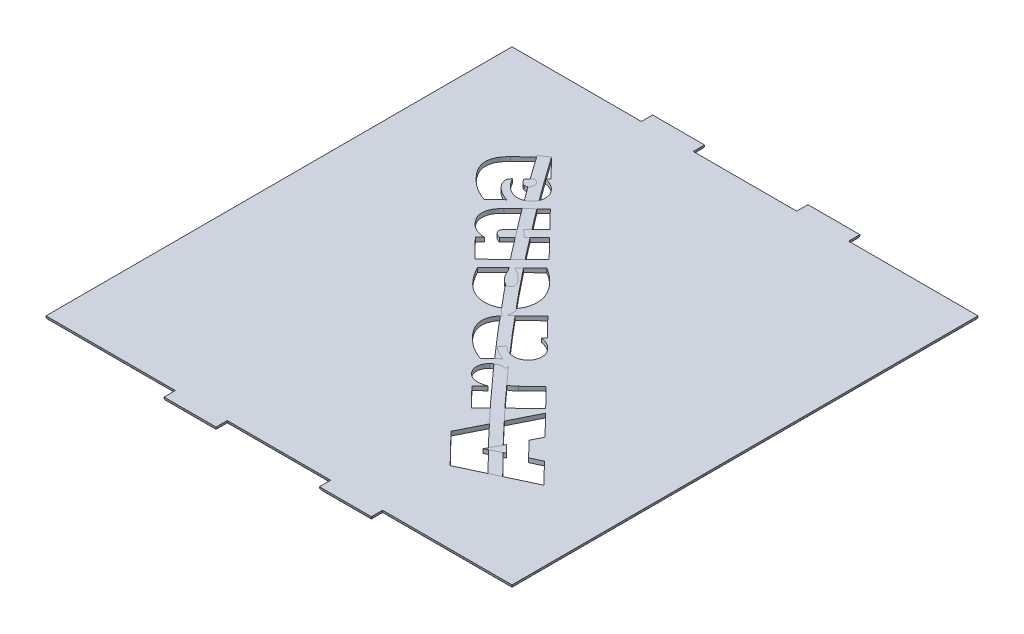
from build123d import *

# Parameters (mm, degrees)
SKETCH3_W           = 89.69
SKETCH3_H           = 89.69000000000001
BOSS_EXTRUDE1_DEPTH = 0.8
BOSS_EXTRUDE2_DEPTH = 2.166
CIRPATTERN1_COUNT   = 2
CUT_EXTRUDE1_DEPTH  = 65.9749809234293
EXTRUDE_THIN5_START = -0.8
EXTRUDE_THIN5_DEPTH = 0.8
FILLET1_R           = 0.7


# Read off the part's stored shape, not the designer's step: Extrude-Thin5
with BuildPart() as part:
    # Sketch3 → Boss-Extrude1 (new body)
    with BuildSketch(Plane(origin=(0, 0, 0), x_dir=(1, 0, 0), z_dir=(0, 1, 0))):
        Rectangle(SKETCH3_W, SKETCH3_H)
    extrude(amount=BOSS_EXTRUDE1_DEPTH)

    # 3DSketch2 → Boss-Extrude2 (add)
    with BuildSketch(Plane(origin=(-9.95034, 0.8, -44.84500000000001), x_dir=(0.9996421745782685, -0.026749258016448483, 0), z_dir=(0, 0, -1))):
        Polygon((0, 0), (-9.996421745782685, 0.26749258016448485), (-9.975022339369527, 1.0672063198270998), (0.02139940641315879, 0.7997137396626148), align=None)
        Polygon((19.889550465666197, -0.53222115949813), (29.885972211448884, -0.7997137396626148), (29.90737161786204, 0), (19.910949872079353, 0.26749258016448485), align=None)
    boss_extrude2 = extrude(amount=BOSS_EXTRUDE2_DEPTH)

    # CirPattern1: Boss-Extrude2 ×2 about axis
    cirpattern1_axis = Axis((0, 0, 0), (0, 1, 0))
    for i in range(1, CIRPATTERN1_COUNT):
        add(boss_extrude2.rotate(cirpattern1_axis, i * 360 / CIRPATTERN1_COUNT))

    # Sketch6 → Cut-Extrude1 (cut, through all)
    # profile 1 of 6: a face of its own
    with BuildSketch(Plane(origin=(0, 0.8, 0), x_dir=(1, 0, 0), z_dir=(0, 1, 0))):
        Polygon((27.345661875247625, -21.096446060445984), (31.303026911258364, -25.166449569967465), (19.007911758263578, -30.913514796204446), (13.368478851159088, -25.11388494899579), (19.453459497928293, -12.98146981329429), (23.408321456749906, -17.04897024562665), (22.36704134607282, -19.088978154765645), (25.275617039839098, -22.077652318584004), align=None)
        Polygon((22.387065963585844, -23.444332463847672), (20.920262730757067, -21.937479995992856), (19.370857950687082, -24.91113569667645), align=None, mode=Mode.SUBTRACT)
    # profile 2 of 6: a face of its own
    with BuildSketch(Plane(origin=(0, 0.8, 0), x_dir=(1, 0, 0), z_dir=(0, 1, 0))):
        with BuildLine():
            add(Edge.make_bspline(
                [(9.400871000961562, -13.988766329086499), (9.30525286068596, -14.023952983668208), (9.117966243026586, -14.09287285080181), (8.83709843493686, -14.177615368293507), (8.56405297163511, -14.246146980475793), (8.29884162387254, -14.295082923044426), (8.042722211750768, -14.33256636169078), (7.794093087022929, -14.346794708899012), (7.5531837904540495, -14.344860433968732), (7.319685892106796, -14.324865851185468), (7.0943759280280085, -14.287779506459136), (6.877565148803457, -14.232225465589547), (6.66888112253963, -14.15968637297079), (6.4687256832569835, -14.068523267258296), (6.273881875267599, -13.96387030835028), (6.089294906722166, -13.838100730971776), (5.912587694344752, -13.694831347614109), (5.803922108485169, -13.587547258560662), (5.748881382024389, -13.533206280665274)],
                knots=[0, 0, 0, 0, 1.2470968480417834, 2.442680331265641, 3.5897166425600027, 4.691564114130364, 5.743217333763314, 6.756314169319222, 7.736965036863193, 8.6904272369132, 9.622418292096572, 10.529158202777579, 11.427226509285706, 12.32331758601569, 13.219233991795686, 14.131480470769954, 15.053567222028589, 16, 16, 16, 16], degree=3))
            add(Edge.make_bspline(
                [(5.748881382024389, -13.533206280665274), (5.690136753953278, -13.469981527582018), (5.575370318719674, -13.346462496682598), (5.42612666426808, -13.147312162314009), (5.304275881076175, -12.940288612475973), (5.199234189581776, -12.729967700538477), (5.121346442661915, -12.510609254452023), (5.069031160605179, -12.283723286144768), (5.03929421575713, -12.05063127589298), (5.031122655860338, -11.813327592436481), (5.049111203482392, -11.57688206658625), (5.089251745516087, -11.344629081981457), (5.15210003632347, -11.11909525384816), (5.2364269611829375, -10.899991027256927), (5.3491682080941, -10.690837250699003), (5.482676468053031, -10.487697498213414), (5.636537331258983, -10.289054728112454), (5.755931499340013, -10.16791272812565), (5.816464466130834, -10.106493608749586)],
                knots=[0, 0, 0, 0, 1.0780730738855722, 2.10617732503832, 3.1022150396295256, 4.076846698501837, 5.039863495431567, 6.003501029278832, 6.981251161032279, 7.972309886930025, 8.965560253553598, 9.939243256954995, 10.913205372588985, 11.887167488222978, 12.866695146964533, 13.876015758160129, 14.923137791049747, 15.999999999999998, 15.999999999999998, 15.999999999999998, 15.999999999999998], degree=3))
            add(Edge.make_bspline(
                [(5.816464466130834, -10.106493608749586), (5.882167013639532, -10.045195417651504), (6.011479921107687, -9.924550973653616), (6.2192827215987005, -9.768238145596452), (6.430232358901273, -9.633369572490553), (6.647215179285657, -9.525754647662053), (6.868611938003697, -9.438843778930314), (7.096369022333233, -9.379128736855252), (7.3288298850668605, -9.344418172601458), (7.563622320139011, -9.331052792306194), (7.798355126818786, -9.34454316185485), (8.02939535269302, -9.378398917372005), (8.254242928123883, -9.439576549531232), (8.471546768611146, -9.524442413914365), (8.682336134547645, -9.634501386693387), (8.887456213863496, -9.766830189381203), (9.085717516662875, -9.925047908231413), (9.208322339452762, -10.045301438813947), (9.270710987126927, -10.106493608749586)],
                knots=[0, 0, 0, 0, 1.1091658733128587, 2.183012217654907, 3.2065780238042447, 4.1974571555349955, 5.169671954735377, 6.139535301474714, 7.09855200252152, 8.068634329472888, 9.038716656424263, 9.997733357471063, 10.94768179659926, 11.910290850553556, 12.873616767535134, 13.879811457034402, 14.921121592120674, 16, 16, 16, 16], degree=3))
            add(Edge.make_bspline(
                [(9.270710987126927, -10.106493608749586), (9.339346746568706, -10.180029134395012), (9.475038018701262, -10.325407128357885), (9.643513230148239, -10.568156702736694), (9.788443814496135, -10.819573561571822), (9.903734225126486, -11.084114462122987), (9.992233443626944, -11.359849653429825), (10.049035483007739, -11.64874381531911), (10.080794755951283, -11.948892390606847), (10.076417718201174, -12.153108765953561), (10.074198764836888, -12.256636914210198)],
                knots=[0, 0, 0, 0, 1.0203363268455545, 2.0171807716380687, 2.9925092336304155, 3.963854337808373, 4.941976179168395, 5.927411182846927, 6.949294433548862, 8, 8, 8, 8], degree=3))
            add(Edge.make_bspline(
                [(10.074198764836888, -12.256636914210198), (10.159395023656488, -12.260135391955167), (10.334006356046563, -12.267305587792983), (10.601716317500948, -12.226557323144595), (10.876664515392799, -12.145027829568782), (11.158915628208959, -12.019497329768146), (11.44885325043191, -11.852890980465267), (11.747816996280946, -11.645249119258828), (12.056247028054226, -11.397430332599706), (12.255719682625134, -11.20852025390121), (12.35950823851039, -11.110227561589754)],
                knots=[0, 0, 0, 0, 0.7756678988863153, 1.5897459253878778, 2.4535868612896894, 3.3832010332191818, 4.398072679927057, 5.49700770663279, 6.697656297404097, 8, 8, 8, 8], degree=3))
            Line((12.35950823851039, -11.110227561589754), (15.062831602768203, -8.481996513005772))
            Line((15.062831602768203, -8.481996513005772), (18.684784295435847, -12.204072293238518))
            Line((18.684784295435847, -12.204072293238518), (11.433369678533179, -19.257743812200108))
            Line((11.433369678533179, -19.257743812200108), (7.8114169858655345, -15.535668031967358))
            Line((7.8114169858655345, -15.535668031967358), (9.400871000961562, -13.988766329086499))
        make_face()
    # profile 3 of 6: a face of its own
    with BuildSketch(Plane(origin=(0, 0.8, 0), x_dir=(1, 0, 0), z_dir=(0, 1, 0))):
        with BuildLine():
            Line((6.2958240907266845, -8.01987409046408), (4.115643858996542, -10.139980469655162))
            add(Edge.make_bspline(
                [(4.115643858996542, -10.139980469655162), (3.917798589734516, -10.074120532651904), (3.5215541498406937, -9.94221627258726), (2.942867460332194, -9.697678227168701), (2.3783070093412095, -9.414486626991474), (1.828707453270959, -9.089888171872614), (1.2931185524698785, -8.726689935728723), (0.7712269326373952, -8.324139954982355), (0.26126207858193917, -7.884647036361315), (-0.05977617846775196, -7.563886339032658), (-0.22218890976159583, -7.401614024749563)],
                knots=[0, 0, 0, 0, 0.9650954006777207, 1.932892749531347, 2.905488665337616, 3.8873074691908958, 4.88584604915965, 5.899534471756508, 6.937377910764731, 8, 8, 8, 8], degree=3))
            add(Edge.make_bspline(
                [(-0.22218890976159583, -7.401614024749563), (-0.3695602363050927, -7.245860832456416), (-0.6543659759916659, -6.944856531416201), (-1.0322642102212125, -6.476181415222208), (-1.361232552753932, -6.019266287927492), (-1.630779577552418, -5.56550063551722), (-1.8427561720647156, -5.1167918319008185), (-2.0035389577753895, -4.67593519959767), (-2.1046744987060158, -4.2396271290824075), (-2.151342762600663, -3.8092015927360627), (-2.1411678452169274, -3.382551853999686), (-2.0752666988921096, -2.9585778309481796), (-1.9529242431326947, -2.536959927596854), (-1.7763538453488903, -2.118459467370514), (-1.5453734062893074, -1.7022625017285338), (-1.2606272012263522, -1.288899326880556), (-0.9217217367603354, -0.8773348439162342), (-0.6648684462156266, -0.6171319343321686), (-0.5325704812134193, -0.4831086740008659)],
                knots=[0, 0, 0, 0, 1.291018980217257, 2.494987486603488, 3.6230635908757387, 4.679712690795654, 5.668835776370349, 6.6082628073706084, 7.500593082884645, 8.359686437399823, 9.209216686589338, 10.063534479166329, 10.936754457779399, 11.846740258794313, 12.793677952430484, 13.798682324594719, 14.86616267145382, 16, 16, 16, 16], degree=3))
            Line((-0.5325704812134193, -0.4831086740008659), (3.4798622529581302, 3.419188663849068))
            Line((3.4798622529581302, 3.419188663849068), (7.099311868436645, -0.3028871163836787))
            Line((7.099311868436645, -0.3028871163836787), (6.556144118395955, -0.8310364032896029))
            add(Edge.make_bspline(
                [(6.556144118395955, -0.8310364032896029), (6.671686925344829, -0.8534791093785119), (6.89977909754282, -0.8977830839572613), (7.23110317530704, -0.993897430259155), (7.5485662754210905, -1.112858269069044), (7.853997700529574, -1.2510428623859828), (8.143939016027941, -1.4183180628205359), (8.418061136243537, -1.6090339798067554), (8.681938047245923, -1.819476009995363), (8.842787646904055, -1.9776357537087084), (8.924055139310667, -2.0575442259621286)],
                knots=[0, 0, 0, 0, 1.0410867210175414, 2.055201339780906, 3.048050713071126, 4.039114261068837, 5.01803131930443, 6.005127070262209, 6.992112376939818, 8, 8, 8, 8], degree=3))
            add(Edge.make_bspline(
                [(8.924055139310667, -2.0575442259621286), (8.987605083093134, -2.1276079378215083), (9.112374952935076, -2.2651665207096636), (9.280126953792404, -2.483086783333591), (9.416802176393004, -2.7130840951323867), (9.534117287579928, -2.9478820144588496), (9.62138563019347, -3.192731500835875), (9.684486852231084, -3.4442075598578015), (9.72194863002238, -3.7033597554144775), (9.734149708255192, -3.9673993126898175), (9.721923974834038, -4.230570211017046), (9.685090522811779, -4.488443245275521), (9.618804787088173, -4.737252778166727), (9.528876088264042, -4.978179174119368), (9.413089726237738, -5.20981467661442), (9.270875904770698, -5.430978392387345), (9.106417398935406, -5.64598585170023), (8.977311833472452, -5.775974814285167), (8.91153975336503, -5.842196935923066)],
                knots=[0, 0, 0, 0, 1.0728392675348166, 2.1063435749029544, 3.112667012568821, 4.103110760035073, 5.079069426922334, 6.054615009021325, 7.039708643552971, 8.044027406495347, 9.048346169437727, 10.024075366366517, 10.992802733717246, 11.963146841951891, 12.936624370791318, 13.923807091030548, 14.942295587045088, 16, 16, 16, 16], degree=3))
            add(Edge.make_bspline(
                [(8.91153975336503, -5.842196935923066), (8.833717890398589, -5.9140113013078945), (8.680275762479255, -6.0556083875223035), (8.42918215241679, -6.234702578542054), (8.169924026405727, -6.3846652738642335), (7.8995616333295775, -6.501139287086897), (7.61873008063165, -6.583609417815766), (7.327255252945571, -6.633556179596776), (7.02694019401994, -6.653750134660128), (6.718984730528258, -6.640907300890574), (6.409772678876227, -6.595312256343912), (6.1024894210983165, -6.5205405235906095), (5.801837470272435, -6.411999599774023), (5.5073913982743585, -6.272873754521337), (5.21780829359211, -6.104592613949386), (4.935489503025496, -5.902498011484127), (4.656318440932066, -5.673040818851408), (4.4822335601224355, -5.499922858407096), (4.393485426989706, -5.4116676593931174)],
                knots=[0, 0, 0, 0, 0.9968445531779354, 1.9654881496525531, 2.898584328167537, 3.8141316852274536, 4.731970947665578, 5.649540871307656, 6.5949398325688575, 7.562626050366091, 8.547590918809714, 9.53518721007581, 10.537225307210484, 11.553500005161785, 12.599734980799724, 13.688090146525257, 14.821392860121962, 16, 16, 16, 16], degree=3))
            add(Edge.make_bspline(
                [(4.393485426989706, -5.4116676593931174), (4.289830664913229, -5.302310106778818), (4.083563791532303, -5.084695016005669), (3.8074004703607565, -4.729595633032135), (3.5469467677546693, -4.364853884692459), (3.396959952523826, -4.106322301893311), (3.322168390043092, -3.9774044300230003)],
                knots=[0, 0, 0, 0, 1.0066252449574393, 2.0031249677703005, 3.0042497834935458, 3.9999999999999996, 3.9999999999999996, 3.9999999999999996, 3.9999999999999996], degree=3))
            add(Edge.make_bspline(
                [(3.322168390043092, -3.9774044300230003), (3.281931695243414, -4.018220481086608), (3.2035821605666626, -4.097698147532556), (3.105080213051563, -4.230168142516031), (3.0248884995876226, -4.366884167475498), (2.963732340278862, -4.509882457281827), (2.920463052542314, -4.65768271914806), (2.8989001463582498, -4.811837139543161), (2.8930393456756565, -4.970622923556342), (2.9151596101526325, -5.1913484388308895), (2.9859104069779048, -5.477991575364124), (3.150165113676964, -5.817408538277743), (3.381063812936603, -6.162156988888748), (3.576804057213031, -6.375432187559775), (3.6801084280883387, -6.4879908507179875)],
                knots=[0, 0, 0, 0, 0.7210279597880231, 1.403997157807597, 2.0725898865682733, 2.7127546189265366, 3.3579012531318972, 4.005780124588256, 4.668068364235937, 5.3539410816210165, 6.79377509292688, 8.359103805842356, 10.078471332504341, 12.000000000000002, 12.000000000000002, 12.000000000000002, 12.000000000000002], degree=3))
            add(Edge.make_bspline(
                [(3.6801084280883387, -6.4879908507179875), (3.7647952020709687, -6.57195682331052), (3.9357779045911907, -6.741484226923214), (4.216902705933815, -6.972125646576786), (4.51502371198186, -7.188314677843004), (4.833550683112851, -7.3867940319991545), (5.1698785626986385, -7.571569193646055), (5.526762413500338, -7.739672637558288), (5.903172052815063, -7.890239419070536), (6.163508913303099, -7.97619003208783), (6.2958240907266845, -8.01987409046408)],
                knots=[0, 0, 0, 0, 0.9341497908080096, 1.8860495952273977, 2.846089266117819, 3.8185187710367177, 4.825168436784824, 5.851836154477159, 6.908204240373605, 7.999999999999999, 7.999999999999999, 7.999999999999999, 7.999999999999999], degree=3))
        make_face()
        with BuildLine():
            Line((5.497342467394979, -1.859801128021048), (4.4860992829874276, -2.843510463348196))
            add(Edge.make_bspline(
                [(4.4860992829874276, -2.843510463348196), (4.521783837814088, -2.914987789092113), (4.591101553497544, -3.053833431634041), (4.708186286105613, -3.245549814243446), (4.831221459154704, -3.4156625380458414), (4.920795977174507, -3.515859834393083), (4.9641870261108, -3.5643966938169456)],
                knots=[0, 0, 0, 0, 1.1035845865510303, 2.143727530713993, 3.100797734283364, 4, 4, 4, 4], degree=3))
            add(Edge.make_bspline(
                [(4.9641870261108, -3.5643966938169456), (5.018583627075594, -3.6162244986682324), (5.122803388520858, -3.7155226416041987), (5.297366422760873, -3.8309086374610617), (5.478948582366619, -3.9045333275115532), (5.66298536115089, -3.9440301977306587), (5.846327449016895, -3.9422312549227323), (6.020622546091713, -3.8982533165013167), (6.183414239067036, -3.8161786649352396), (6.275705397611079, -3.7359704720494955), (6.323357939807088, -3.6945567076515813)],
                knots=[0, 0, 0, 0, 1.1742740398676297, 2.2498199912450154, 3.2511668787771675, 4.224194076906051, 5.177397617167302, 6.092554234216523, 7.0151316629402, 8, 8, 8, 8], degree=3))
            add(Edge.make_bspline(
                [(6.323357939807088, -3.6945567076515813), (6.368052993577698, -3.6453020479546274), (6.455008417332937, -3.549475788792926), (6.5482744932508234, -3.3790061637184983), (6.598758696387186, -3.1921554450282357), (6.607045694662305, -2.9945040192808174), (6.579872915730077, -2.794068809523421), (6.513788039087678, -2.598263817904969), (6.406794665798402, -2.4116894044641923), (6.308891328821463, -2.3036378461558913), (6.25827793288977, -2.247778092335827)],
                knots=[0, 0, 0, 0, 0.9848626250512957, 1.9160766052897056, 2.853612322343142, 3.833398905935222, 4.833641883268787, 5.840306541518968, 6.88349648254646, 8, 8, 8, 8], degree=3))
            add(Edge.make_bspline(
                [(6.25827793288977, -2.247778092335827), (6.20238014111139, -2.194772487147742), (6.094112916729506, -2.0921070764433485), (5.906287911226157, -1.9754747189914104), (5.707933883796675, -1.8913225314392577), (5.567344475250322, -1.8702790552195812), (5.497342467394979, -1.859801128021048)],
                knots=[0, 0, 0, 0, 1.058153420954703, 2.0495144837058383, 3.0288180038232464, 4, 4, 4, 4], degree=3))
        make_face(mode=Mode.SUBTRACT)
    # profile 4 of 6: a face of its own
    with BuildSketch(Plane(origin=(0, 0.8, 0), x_dir=(1, 0, 0), z_dir=(0, 1, 0))):
        with BuildLine():
            Line((-11.373584904053017, 4.73842336063162), (-8.19467687386096, 7.8322267663933385))
            add(Edge.make_bspline(
                [(-8.19467687386096, 7.8322267663933385), (-8.148523971454793, 7.699864733226076), (-8.058026895625705, 7.440327925616129), (-7.900876823462813, 7.067168793105496), (-7.737449267944452, 6.714633784081509), (-7.561360176935482, 6.38438784347097), (-7.373204153105927, 6.0766397378292645), (-7.176812577833482, 5.788828080598937), (-6.968279625883738, 5.523098766935609), (-6.817475773531251, 5.361509142719898), (-6.742892104166952, 5.281591110672309)],
                knots=[0, 0, 0, 0, 1.1368732229947582, 2.229192464733668, 3.2829163743784915, 4.288226369464313, 5.263302015326405, 6.207636311630955, 7.113543463058034, 8, 8, 8, 8], degree=3))
            add(Edge.make_bspline(
                [(-6.742892104166952, 5.281591110672309), (-6.658625895336122, 5.198779003653916), (-6.4991909294700685, 5.042095255340521), (-6.247803802992604, 4.848663697937698), (-6.006360365547296, 4.70040475664412), (-5.770459386930191, 4.608328948994399), (-5.546377252617174, 4.568337471450006), (-5.337932469591617, 4.57724832054834), (-5.148168126203769, 4.647557275657318), (-5.047092812206779, 4.731050142893712), (-4.9957442261558835, 4.773466441279406)],
                knots=[0, 0, 0, 0, 1.4030584800871566, 2.654641569669563, 3.761804590506423, 4.759994145437661, 5.645247016505519, 6.450025383481633, 7.21257721766397, 8, 8, 8, 8], degree=3))
            add(Edge.make_bspline(
                [(-4.9957442261558835, 4.773466441279406), (-4.9435305646801995, 4.830873244703239), (-4.842966079213769, 4.941439818382021), (-4.756119643758197, 5.15128096625114), (-4.738256242949842, 5.379026673660398), (-4.7825466002885095, 5.622732379234989), (-4.887789069047334, 5.882155450074249), (-5.055447807947662, 6.1572840203177535), (-5.280093969044431, 6.4542646793754335), (-5.461773346963419, 6.647535173716775), (-5.5589365937095945, 6.7508974206902135)],
                knots=[0, 0, 0, 0, 0.8058678386221194, 1.5521164816743827, 2.3223128552540144, 3.162022136524155, 4.117002761402586, 5.2306769701718245, 6.518949041167224, 8, 8, 8, 8], degree=3))
            add(Edge.make_bspline(
                [(-5.5589365937095945, 6.7508974206902135), (-5.648207039107863, 6.840223168470665), (-5.823112847707261, 7.015237329927829), (-6.09530201141455, 7.258308703846254), (-6.366346912239563, 7.482491170251773), (-6.643478310489833, 7.679167794211027), (-6.91839290601632, 7.858967025401315), (-7.196551396551222, 8.013366928785754), (-7.474911588242117, 8.148598321848857), (-7.665094057527629, 8.219958429676618), (-7.7591414429527585, 8.255246811355903)],
                knots=[0, 0, 0, 0, 1.1271606004732875, 2.208423351845229, 3.2565712955715282, 4.265312042497156, 5.240495074497097, 6.1875080140601515, 7.103702181268121, 8, 8, 8, 8], degree=3))
            Line((-7.7591414429527585, 8.255246811355903), (-4.615276493408487, 11.311504059280708))
            add(Edge.make_bspline(
                [(-4.615276493408487, 11.311504059280708), (-4.38678042916182, 11.175815208573027), (-3.924968401946662, 10.901575284912186), (-3.2694915114131198, 10.418276054044405), (-2.6290775832579816, 9.886536406197454), (-2.2311403002114187, 9.491562470100927), (-2.0295977570396735, 9.291520767654731)],
                knots=[0, 0, 0, 0, 0.9682636580929956, 1.9569518814117255, 2.965261283159663, 3.9999999999999996, 3.9999999999999996, 3.9999999999999996, 3.9999999999999996], degree=3))
            add(Edge.make_bspline(
                [(-2.0295977570396735, 9.291520767654731), (-1.8610433029298477, 9.111866174844955), (-1.5332098063015558, 8.762443232228527), (-1.0958620197791271, 8.214722070402646), (-0.7221579823936254, 7.665181197681254), (-0.40434014863948825, 7.117388261596463), (-0.15937829830558162, 6.56307230925372), (0.02884784791680292, 6.010740564793517), (0.15298130359191203, 5.45605941709676), (0.21301051557917788, 4.903536293682811), (0.21195519384604616, 4.360813945422119), (0.160555596942036, 3.8356334449665335), (0.05508987337652294, 3.3299920676136976), (-0.10584173696484812, 2.8444808460552906), (-0.32255041865378353, 2.378290446174529), (-0.5957723655061278, 1.9341189854807233), (-0.9189739592736715, 1.507432050030281), (-1.1706813138499943, 1.248276639617007), (-1.2986992178144128, 1.116470667963977)],
                knots=[0, 0, 0, 0, 1.2796779118770631, 2.488936211292874, 3.6373020332130017, 4.730528232582266, 5.774667070597856, 6.780965860313314, 7.7581252484264525, 8.721882073496843, 9.662664100877285, 10.573325385043589, 11.45931844855162, 12.340855917604099, 13.22533085968173, 14.124265577358248, 15.046004875047485, 16, 16, 16, 16], degree=3))
            add(Edge.make_bspline(
                [(-1.2986992178144128, 1.116470667963977), (-1.434079783120442, 0.9919423986117573), (-1.7004740386358848, 0.7469026801726903), (-2.1346219659905485, 0.43047313690895683), (-2.5853906422957458, 0.16424350620947073), (-3.055274584755688, -0.0521241160146645), (-3.5447533838269782, -0.21062762120690123), (-4.051707025335223, -0.3230816926603526), (-4.5770762140684464, -0.37860860080381575), (-5.1151808805705254, -0.38709137335585087), (-5.658119446835338, -0.33990800669574867), (-6.195297557546355, -0.2346601893486085), (-6.722037414536905, -0.07029782171245738), (-7.237438485925027, 0.15188450017858096), (-7.742324467374263, 0.43083703111032373), (-8.234311818562967, 0.7706271056125917), (-8.719753114409704, 1.1624055316301496), (-9.021570310697818, 1.461607380000976), (-9.175883131998981, 1.6145830286003702)],
                knots=[0, 0, 0, 0, 0.9963066501217921, 1.960476141640541, 2.9051048413169815, 3.829879405932681, 4.7579649460218, 5.688427093163427, 6.639248447852295, 7.616112897028493, 8.601159500822348, 9.587347225807813, 10.577115718272886, 11.585946039717882, 12.624274141254316, 13.69794308519479, 14.823006436716305, 16, 16, 16, 16], degree=3))
            add(Edge.make_bspline(
                [(-9.175883131998981, 1.6145830286003702), (-9.282753301149276, 1.7272277098021391), (-9.496709476710715, 1.952744571793577), (-9.802171068674339, 2.3069755030678145), (-10.09634425967418, 2.6752615217381464), (-10.374431880643572, 3.06033054984897), (-10.64436880797596, 3.457772337008402), (-10.902073322264956, 3.869460219500056), (-11.14421398097358, 4.29839332816835), (-11.296811123591768, 4.591138915615053), (-11.373584904053017, 4.73842336063162)],
                knots=[0, 0, 0, 0, 0.9718019714462098, 1.945566614770626, 2.9267675062315637, 3.921249180489924, 4.917826766602743, 5.933663736935415, 6.960397004178659, 7.999999999999999, 7.999999999999999, 7.999999999999999, 7.999999999999999], degree=3))
        make_face()
    # profile 5 of 6: a face of its own
    with BuildSketch(Plane(origin=(0, 0.8, 0), x_dir=(1, 0, 0), z_dir=(0, 1, 0))):
        with BuildLine():
            Line((-16.64968652630597, 9.588800896121462), (-15.74106950665265, 10.474890221072634))
            add(Edge.make_bspline(
                [(-15.74106950665265, 10.474890221072634), (-15.894802514369514, 10.478554000269153), (-16.196805304038094, 10.485751358562666), (-16.64015835669822, 10.547997390744863), (-17.06511065678825, 10.646652166404436), (-17.471279408611196, 10.790615374705695), (-17.857107067460195, 10.976998442202389), (-18.22573988109571, 11.201530316823723), (-18.57643764229251, 11.466680137359704), (-18.787805464764013, 11.673936310870642), (-18.89494676495343, 11.778993436608117)],
                knots=[0, 0, 0, 0, 1.050464339874953, 2.0635982200639655, 3.0541478966612505, 4.028288412807544, 5.002796207871365, 5.978054824458185, 6.975086025459392, 8, 8, 8, 8], degree=3))
            add(Edge.make_bspline(
                [(-18.89494676495343, 11.778993436608117), (-18.992837529859145, 11.88329310980098), (-19.183636747498287, 12.086583952041144), (-19.430519918850433, 12.411850995046905), (-19.643596434247275, 12.736167958419374), (-19.812143831288722, 13.066323358992838), (-19.94166921526934, 13.398235144587712), (-20.029435877926737, 13.73431469260682), (-20.08145033762871, 14.073282690393214), (-20.087795503771375, 14.415501459824291), (-20.05537901655564, 14.759191534756306), (-19.979914899792504, 15.103052072485745), (-19.859463059176015, 15.44522137106933), (-19.7022476661105, 15.788099825507672), (-19.495143238399415, 16.126186868130564), (-19.252666986308295, 16.466477196948365), (-18.96827953566817, 16.80729958722593), (-18.753224592998688, 17.022112132583405), (-18.642135968851544, 17.13307554415206)],
                knots=[0, 0, 0, 0, 1.1204044202827053, 2.1837840069517314, 3.1959420273098487, 4.158152587526768, 5.083548189166485, 5.982906725098201, 6.875367853584387, 7.764949293589154, 8.658368255598655, 9.575501231094805, 10.516477749644613, 11.496631892884896, 12.526174658594803, 13.618575892544625, 14.769853302025094, 16, 16, 16, 16], degree=3))
            Line((-18.642135968851544, 17.13307554415206), (-14.136597028421855, 21.515963702314497))
            Line((-14.136597028421855, 21.515963702314497), (-10.714890510884423, 17.996637174401084))
            Line((-10.714890510884423, 17.996637174401084), (-14.942587883320945, 13.88408135266443))
            add(Edge.make_bspline(
                [(-14.942587883320945, 13.88408135266443), (-15.01106206837439, 13.813017468585814), (-15.139680370667707, 13.679534812057279), (-15.295163832645489, 13.468718379784397), (-15.402478397650963, 13.262177652808866), (-15.460566556197675, 13.059411633968995), (-15.46736354182214, 12.8599870682127), (-15.418688534793171, 12.668729413443222), (-15.323579377668429, 12.48307225101014), (-15.228175783423717, 12.376071173968397), (-15.17787713909894, 12.319658109459677)],
                knots=[0, 0, 0, 0, 1.3129284341345664, 2.466135611533102, 3.474632819907128, 4.396309981395013, 5.2519588283644385, 6.097962780889854, 6.997208707555495, 8, 8, 8, 8], degree=3))
            add(Edge.make_bspline(
                [(-15.17787713909894, 12.319658109459677), (-15.121040749811666, 12.267591425734395), (-15.00499686859195, 12.161285938396297), (-14.79559390703765, 12.03590329284957), (-14.555881573421528, 11.940877411447078), (-14.383406819834061, 11.901806921202361), (-14.294290891336894, 11.881619601362349)],
                knots=[0, 0, 0, 0, 0.9220930456065791, 1.8826540038822581, 2.9059891348208193, 4, 4, 4, 4], degree=3))
            Line((-14.294290891336894, 11.881619601362349), (-9.398271909403302, 16.64247241508305))
            Line((-9.398271909403302, 16.64247241508305), (-5.7788222939247875, 12.920396634850302))
            Line((-5.7788222939247875, 12.920396634850302), (-13.030236910827456, 5.866725115888716))
            Line((-13.030236910827456, 5.866725115888716), (-16.64968652630597, 9.588800896121462))
        make_face()
    # profile 6 of 6: a face of its own
    with BuildSketch(Plane(origin=(0, 0.8, 0), x_dir=(1, 0, 0), z_dir=(0, 1, 0))):
        with BuildLine():
            Line((-19.854070074384776, 18.838821477956298), (-22.034250306114917, 16.718715098765216))
            add(Edge.make_bspline(
                [(-22.034250306114917, 16.718715098765216), (-22.232095575376945, 16.784575035768473), (-22.628340015270766, 16.91647929583312), (-23.207026704779263, 17.161017341251675), (-23.77158715577025, 17.4442089414289), (-24.3211867118405, 17.768807396547764), (-24.856775612641584, 18.13200563269166), (-25.378667232474065, 18.534555613438023), (-25.888632086529526, 18.974048532059065), (-26.209670343579212, 19.29480922938772), (-26.372083074873057, 19.457081543670817)],
                knots=[0, 0, 0, 0, 0.9650954006777225, 1.932892749531348, 2.905488665337614, 3.887307469190894, 4.885846049159648, 5.899534471756507, 6.937377910764728, 8, 8, 8, 8], degree=3))
            add(Edge.make_bspline(
                [(-26.372083074873057, 19.457081543670817), (-26.51945440141655, 19.61283473596396), (-26.804260141103125, 19.913839037004177), (-27.18215837533267, 20.382514153198173), (-27.511126717865388, 20.839429280492887), (-27.780673742663872, 21.29319493290316), (-27.992650337176176, 21.74190373651956), (-28.153433122886852, 22.182760368822713), (-28.25456866381747, 22.61906843933798), (-28.30123692771212, 23.049493975684314), (-28.29106201032839, 23.47614371442069), (-28.225160864003566, 23.900117737472197), (-28.10281840824415, 24.321735640823526), (-27.926248010460345, 24.740236101049867), (-27.695267571400773, 25.15643306669185), (-27.410521366337814, 25.569796241539827), (-27.071615901871795, 25.981360724504146), (-26.814762611327087, 26.241563634088212), (-26.682464646324878, 26.375586894419513)],
                knots=[0, 0, 0, 0, 1.2910189802172498, 2.4949874866034785, 3.623063590875736, 4.6797126907956486, 5.668835776370351, 6.6082628073706084, 7.500593082884642, 8.35968643739982, 9.209216686589334, 10.063534479166325, 10.936754457779399, 11.846740258794313, 12.793677952430484, 13.79868232459472, 14.866162671453823, 16, 16, 16, 16], degree=3))
            Line((-26.682464646324878, 26.375586894419513), (-22.67003191215333, 30.277884232269443))
            Line((-22.67003191215333, 30.277884232269443), (-19.050582296674815, 26.5558084520367))
            Line((-19.050582296674815, 26.5558084520367), (-19.593750046715503, 26.027659165130775))
            add(Edge.make_bspline(
                [(-19.593750046715503, 26.027659165130775), (-19.47820723976663, 26.00521645904187), (-19.250115067568636, 25.960912484463115), (-18.91879098980442, 25.864798138161227), (-18.60132788969037, 25.745837299351333), (-18.295896464581887, 25.607652706034397), (-18.00595514908352, 25.440377505599844), (-17.731833028867925, 25.249661588613616), (-17.467956117865533, 25.039219558425017), (-17.3071065182074, 24.88105981471167), (-17.22583902580079, 24.80115134245825)],
                knots=[0, 0, 0, 0, 1.0410867210175356, 2.0552013397809064, 3.0480507130711243, 4.039114261068831, 5.018031319304431, 6.0051270702622155, 6.9921123769398195, 8, 8, 8, 8], degree=3))
            add(Edge.make_bspline(
                [(-17.22583902580079, 24.80115134245825), (-17.162289082018326, 24.73108763059887), (-17.037519212176385, 24.59352904771072), (-16.869767211319054, 24.37560878508679), (-16.733091988718456, 24.14561147328799), (-16.615776877531538, 23.910813553961525), (-16.528508534917986, 23.665964067584504), (-16.465407312880377, 23.414488008562575), (-16.427945535089073, 23.1553358130059), (-16.415744456856263, 22.89129625573056), (-16.42797019027742, 22.628125357403338), (-16.46480364229968, 22.370252323144854), (-16.53108937802329, 22.121442790253656), (-16.62101807684742, 21.88051639430101), (-16.736804438873715, 21.64888089180596), (-16.87901826034076, 21.427717176033035), (-17.043476766176052, 21.21270971672015), (-17.172582331639006, 21.082720754135213), (-17.23835441174643, 21.016498632497314)],
                knots=[0, 0, 0, 0, 1.0728392675348104, 2.106343574902952, 3.1126670125688234, 4.103110760035078, 5.079069426922327, 6.05461500902132, 7.039708643552967, 8.044027406495346, 9.048346169437725, 10.024075366366516, 10.992802733717248, 11.963146841951897, 12.936624370791314, 13.923807091030547, 14.942295587045077, 16, 16, 16, 16], degree=3))
            add(Edge.make_bspline(
                [(-17.23835441174643, 21.016498632497314), (-17.31617627471287, 20.944684267112482), (-17.469618402632207, 20.803087180898075), (-17.720712012694666, 20.623992989878328), (-17.979970138705728, 20.474030294556147), (-18.25033253178188, 20.357556281333487), (-18.53116408447981, 20.27508615060462), (-18.822638912165885, 20.225139388823603), (-19.12295397109152, 20.204945433760255), (-19.4309094345832, 20.217788267529805), (-19.740121486235232, 20.26338331207647), (-20.04740474401314, 20.338155044829772), (-20.348056694839023, 20.446695968646356), (-20.6425027668371, 20.585821813899038), (-20.932085871519348, 20.75410295447099), (-21.21440466208596, 20.956197556936253), (-21.493575724179394, 21.18565474956897), (-21.667660604989024, 21.358772710013284), (-21.756408738121753, 21.44702790902726)],
                knots=[0, 0, 0, 0, 0.9968445531779431, 1.965488149652549, 2.898584328167533, 3.8141316852274554, 4.731970947665572, 5.649540871307653, 6.594939832568862, 7.5626260503660925, 8.547590918809714, 9.535187210075806, 10.53722530721049, 11.553500005161789, 12.59973498079973, 13.688090146525262, 14.821392860121962, 16, 16, 16, 16], degree=3))
            add(Edge.make_bspline(
                [(-21.756408738121753, 21.44702790902726), (-21.86006350019823, 21.556385461641558), (-22.06633037357916, 21.774000552414705), (-22.3424936947507, 22.129099935388247), (-22.602947397356793, 22.493841683727922), (-22.752934212587633, 22.752373266527066), (-22.827725775068366, 22.88129113839738)],
                knots=[0, 0, 0, 0, 1.0066252449574455, 2.0031249677702982, 3.004249783493549, 4, 4, 4, 4], degree=3))
            add(Edge.make_bspline(
                [(-22.827725775068366, 22.88129113839738), (-22.867962469868047, 22.840475087333772), (-22.946312004544797, 22.760997420887822), (-23.044813952059894, 22.628527425904345), (-23.12500566552384, 22.491811400944886), (-23.1861618248326, 22.348813111138547), (-23.229431112569145, 22.20101284927232), (-23.250994018753207, 22.046858428877222), (-23.256854819435798, 21.88807264486403), (-23.234734554958827, 21.66734712958949), (-23.16398375813355, 21.380703993056255), (-22.999729051434496, 21.041287030142637), (-22.768830352174852, 20.696538579531627), (-22.57309010789843, 20.483263380860606), (-22.469785737023123, 20.37070471770239)],
                knots=[0, 0, 0, 0, 0.7210279597880235, 1.4039971578075974, 2.0725898865682777, 2.712754618926539, 3.357901253131896, 4.005780124588254, 4.668068364235932, 5.353941081621023, 6.79377509292688, 8.359103805842363, 10.078471332504337, 11.999999999999998, 11.999999999999998, 11.999999999999998, 11.999999999999998], degree=3))
            add(Edge.make_bspline(
                [(-22.469785737023123, 20.37070471770239), (-22.385098963040495, 20.286738745109854), (-22.21411626052027, 20.11721134149716), (-21.93299145917764, 19.886569921843595), (-21.634870453129604, 19.67038089057737), (-21.316343481998604, 19.471901536421235), (-20.980015602412823, 19.287126374774317), (-20.623131751611123, 19.119022930862094), (-20.246722112296393, 18.968456149349844), (-19.98638525180836, 18.88250553633255), (-19.854070074384776, 18.838821477956298)],
                knots=[0, 0, 0, 0, 0.9341497908080125, 1.8860495952274012, 2.8460892661178168, 3.8185187710367163, 4.825168436784821, 5.851836154477159, 6.908204240373604, 8, 8, 8, 8], degree=3))
        make_face()
        with BuildLine():
            Line((-20.65255169771648, 24.99889444039933), (-21.663794882124034, 24.01518510507218))
            add(Edge.make_bspline(
                [(-21.663794882124034, 24.01518510507218), (-21.62811032729737, 23.943707779328268), (-21.55879261161392, 23.80486213678634), (-21.441707879005843, 23.613145754176934), (-21.318672705956754, 23.443033030374536), (-21.229098187936952, 23.342835734027297), (-21.18570713900066, 23.294298874603435)],
                knots=[0, 0, 0, 0, 1.103584586551025, 2.143727530713996, 3.1007977342833635, 3.9999999999999996, 3.9999999999999996, 3.9999999999999996, 3.9999999999999996], degree=3))
            add(Edge.make_bspline(
                [(-21.18570713900066, 23.294298874603435), (-21.131310538035866, 23.242471069752145), (-21.0270907765906, 23.143172926816177), (-20.85252774235058, 23.02778693095932), (-20.67094558274484, 22.954162240908826), (-20.486908803960567, 22.91466537068972), (-20.30356671609456, 22.916464313497645), (-20.129271619019747, 22.960442251919062), (-19.966479926044425, 23.04251690348514), (-19.87418876750038, 23.122725096370885), (-19.82653622530437, 23.164138860768798)],
                knots=[0, 0, 0, 0, 1.174274039867623, 2.249819991245022, 3.251166878777173, 4.224194076906047, 5.177397617167292, 6.09255423421653, 7.015131662940197, 8, 8, 8, 8], degree=3))
            add(Edge.make_bspline(
                [(-19.82653622530437, 23.164138860768798), (-19.78184117153376, 23.213393520465754), (-19.69488574777852, 23.30921977962745), (-19.601619671860636, 23.47968940470188), (-19.551135468724276, 23.666540123392146), (-19.542848470449155, 23.86419154913956), (-19.570021249381384, 24.06462675889696), (-19.63610612602378, 24.26043175051541), (-19.743099499313065, 24.447006163956186), (-19.841002836289995, 24.555057722264486), (-19.891616232221686, 24.610917476084552)],
                knots=[0, 0, 0, 0, 0.9848626250512955, 1.9160766052897036, 2.853612322343147, 3.83339890593522, 4.833641883268793, 5.840306541518966, 6.883496482546461, 8, 8, 8, 8], degree=3))
            add(Edge.make_bspline(
                [(-19.891616232221686, 24.610917476084552), (-19.947514024000068, 24.66392308127264), (-20.05578124838195, 24.76658849197703), (-20.2436062538853, 24.883220849428973), (-20.44196028131478, 24.96737303698112), (-20.58254968986114, 24.988416513200796), (-20.65255169771648, 24.99889444039933)],
                knots=[0, 0, 0, 0, 1.0581534209547092, 2.0495144837058428, 3.028818003823255, 4, 4, 4, 4], degree=3))
        make_face(mode=Mode.SUBTRACT)
    extrude(amount=-CUT_EXTRUDE1_DEPTH, mode=Mode.SUBTRACT)


with BuildPart() as cut_extrude1_piece_1:
    # of the separate pieces the step leaves, piece 1, a body of its own (cut_extrude1_pieces)
    add(part.part.solids().sort_by_distance((44.845, 0, 44.845))[0])

    # Fillet1
    fillet1_edges = [cut_extrude1_piece_1.edges().sort_by_distance(p)[0] for p in [
        (-19.950340000000004, 0, -45.92800000000001),
        (9.946329999999996, 1.1e-16, -45.92800000000001),
        (14.94633, 0, -47.01100000000001),
        (19.950339999999997, 0, 45.92800000000001),
        (-9.946330000000001, 1.1e-16, 45.92800000000001),
        (-14.946330000000005, 0, 47.01100000000001),
        (-32.39566500000001, 0, 44.845),
        (0.00200499999999693, 0, 44.845),
        (32.39767, 0, 44.845),
        (32.395665, 0, -44.84500000000001),
        (-0.00200500000000403, 0, -44.84500000000001),
        (-32.39767, 0, -44.84500000000001),
        (-44.84499999999999, 0, -7.11e-15),
        (44.845, 0, -7.11e-15),
        (-14.95034, -1.1e-16, -47.01100000000001),
        (-9.95034, 0, -45.92800000000001),
        (19.94633, 0, -45.92800000000001),
        (14.950339999999997, -1.1e-16, 47.01100000000001),
        (9.950339999999995, 0, 45.92800000000001),
        (-19.946330000000007, 0, 45.92800000000001),
    ]]
    fillet(fillet1_edges, radius=FILLET1_R)


with BuildPart() as cut_extrude1_piece_2:
    # of the separate pieces the step leaves, piece 2, a body of its own (cut_extrude1_pieces)
    add(part.part.solids().sort_by_distance((19.370857951, 0, 24.911135697))[0])


with BuildPart() as cut_extrude1_piece_3:
    # of the separate pieces the step leaves, piece 3, a body of its own (cut_extrude1_pieces)
    add(part.part.solids().sort_by_distance((4.964187026, 0, 3.564396694))[0])


with BuildPart() as cut_extrude1_piece_4:
    # of the separate pieces the step leaves, piece 4, a body of its own (cut_extrude1_pieces)
    add(part.part.solids().sort_by_distance((-21.185707139, 0, -23.294298875))[0])


with BuildPart() as body_5:
    # Extrude-Thin5 outline → Extrude-Thin5 (new body)
    with BuildSketch(Plane(origin=(0, 0.8, 0), x_dir=(1, 0, 0), z_dir=(0, 1, 0)).offset(EXTRUDE_THIN5_START)):
        with BuildLine():
            Line((24.48683786, -29.106208826), (25.900698321, -27.69164225))
            add(Edge.make_bspline(
                [(25.900698321, -27.69164225), (-0.911163895667988, -0.893163814573428), (-22.670031912, 30.277884232)],
                knots=[0, 0, 0, 1, 1, 1], degree=2))
            Line((-22.670031912, 30.277884232), (-24.309998758, 29.133109694))
            add(Edge.make_bspline(
                [(24.48683786, -29.106208826), (6.52936333056331, -11.1576981984672), (-9.73737164948064, 8.25683711243723), (-24.309998758, 29.133109694)],
                knots=[0, 0, 0, 0, 1, 1, 1, 1], degree=3))
        make_face()
    extrude(amount=EXTRUDE_THIN5_DEPTH)


solid = Compound([cut_extrude1_piece_1.part, cut_extrude1_piece_2.part, cut_extrude1_piece_4.part, body_5.part])
